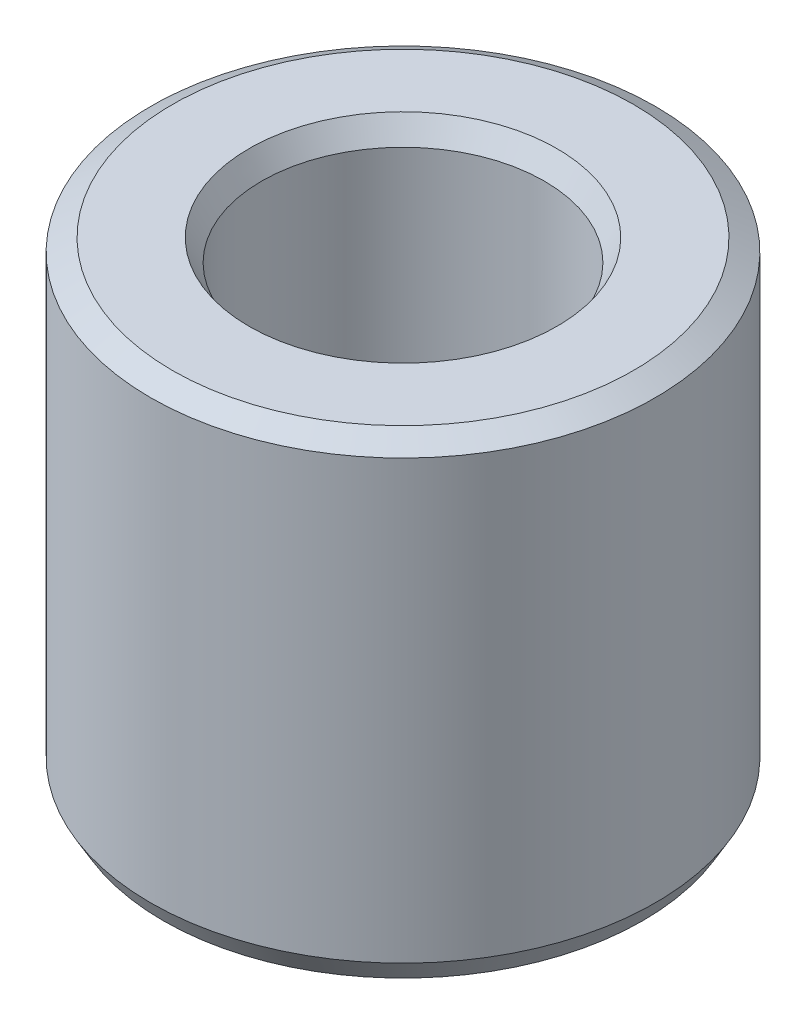
from build123d import *
from OCP.BRepFilletAPI import BRepFilletAPI_MakeChamfer

# Parameters (mm, degrees)
SKETCH1_R           = 7.5
BOSS_EXTRUDE1_DEPTH = 14.025007075
SKETCH2_R           = 4.201525344
CUT_EXTRUDE1_DEPTH  = 18.584107127
CHAMFER1_SIZE       = 0.374869552
CHAMFER1_SIZE2      = 0.64929311


with BuildPart() as part:
    # Sketch1 → Boss-Extrude1 (new body)
    with BuildSketch(Plane(origin=(0, 0, 0), x_dir=(1, 0, 0), z_dir=(0, 1, 0))):
        Circle(SKETCH1_R)
    extrude(amount=BOSS_EXTRUDE1_DEPTH)

    # Sketch2 → Cut-Extrude1 (cut, through all)
    with BuildSketch(Plane(origin=(0, 0, 0), x_dir=(1, 0, 0), z_dir=(0, 1, 0))):
        Circle(SKETCH2_R)
    extrude(amount=CUT_EXTRUDE1_DEPTH, mode=Mode.SUBTRACT)

    # Chamfer1: one chamfer whose edges measure the first distance from different faces: ONE call of the kernel's chamfer builder (chamfer() names one face for all edges)
    chamfer1_edges_1 = [part.edges().sort_by_distance(p)[0] for p in [
        (-4.201525344, 14.025007075, 0),
    ]]
    chamfer1_side_1 = [part.faces().sort_by_distance(p)[0] for p in [
        (-7.287867966, 14.025007075, 0),
    ]]
    chamfer1_edges_2 = [part.edges().sort_by_distance(p)[0] for p in [
        (-4.201525344, 0, 0),
    ]]
    chamfer1_side_2 = [part.faces().sort_by_distance(p)[0] for p in [
        (-4.201525344, 7.012503537, 0),
    ]]
    chamfer1_edges_3 = [part.edges().sort_by_distance(p)[0] for p in [
        (-7.5, 0, 0),
    ]]
    chamfer1_side_3 = [part.faces().sort_by_distance(p)[0] for p in [
        (-7.287867966, 0, 0),
    ]]
    chamfer1_edges_4 = [part.edges().sort_by_distance(p)[0] for p in [
        (-7.5, 14.025007075, 0),
    ]]
    chamfer1_side_4 = [part.faces().sort_by_distance(p)[0] for p in [
        (-7.5, 7.012503537, 0),
    ]]
    chamfer1 = BRepFilletAPI_MakeChamfer(part.part.solid().wrapped)
    for e in chamfer1_edges_1:
        chamfer1.Add(CHAMFER1_SIZE, CHAMFER1_SIZE2, e.wrapped, chamfer1_side_1[0].wrapped)  # the first distance lies on this face
    for e in chamfer1_edges_2:
        chamfer1.Add(CHAMFER1_SIZE, CHAMFER1_SIZE2, e.wrapped, chamfer1_side_2[0].wrapped)  # the first distance lies on this face
    for e in chamfer1_edges_3:
        chamfer1.Add(CHAMFER1_SIZE, CHAMFER1_SIZE2, e.wrapped, chamfer1_side_3[0].wrapped)  # the first distance lies on this face
    for e in chamfer1_edges_4:
        chamfer1.Add(CHAMFER1_SIZE, CHAMFER1_SIZE2, e.wrapped, chamfer1_side_4[0].wrapped)  # the first distance lies on this face
    add(Compound.cast(chamfer1.Shape()), mode=Mode.REPLACE)


solid = part.part
